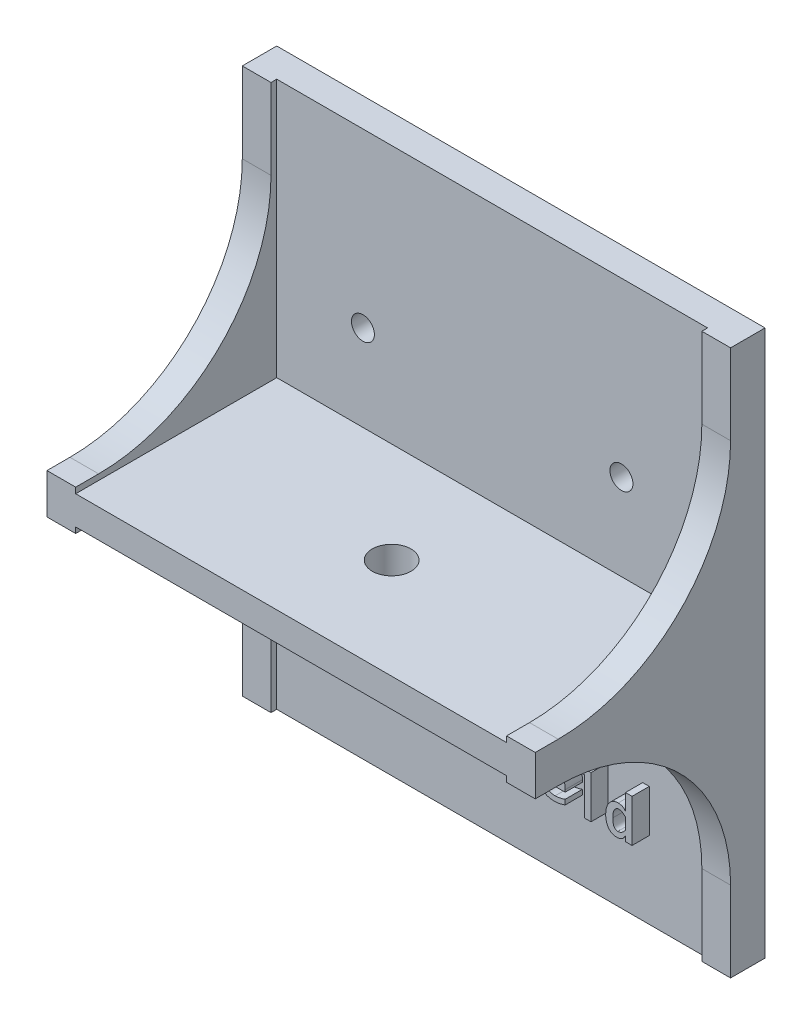
from build123d import *

# Parameters (mm, degrees)
SKETCH1_W               = 85
SKETCH1_H               = 35
SKETCH1_H_2             = 5
BOSS_EXTRUDE1_DEPTH     = 5
SKETCH1_3_W             = 85
SKETCH1_3_H             = 5
BOSS_EXTRUDE2_DEPTH     = 45
BOSS_EXTRUDE3_START     = 5
SKETCH1_4_W             = 85
SKETCH1_4_H             = 5
BOSS_EXTRUDE3_DEPTH     = 45
SKETCH2_W               = 5
SKETCH2_H               = 35
BOSS_EXTRUDE4_DEPTH     = 1
BOSS_EXTRUDE5_START     = -5
SKETCH2_2_W             = 5
SKETCH2_2_H             = 35
BOSS_EXTRUDE5_DEPTH     = 1
SKETCH3_W               = 5
SKETCH3_H               = 95
BOSS_EXTRUDE6_DEPTH     = 1
FILLET1_R               = 30
CUT_EXTRUDE1_REACH      = 106.642
SKETCH4_R               = 2
BOSS_EXTRUDE7_OUTLINE_W = 1.411764706
BOSS_EXTRUDE7_OUTLINE_H = 1.323529412
BOSS_EXTRUDE7_DEPTH     = 3
CUT_EXTRUDE2_REACH      = 106.642
SKETCH8_R               = 3.3734375


# Read off the part's stored shape, not the designer's step: Boss-Extrude7
with BuildPart() as part:
    # Sketch1 → Boss-Extrude1 (new body)
    with BuildSketch(Plane(origin=(0, 0, 0), x_dir=(1, 0, 0), z_dir=(0, 1, 0))):
        with Locations((42.5, -17.5)):
            Rectangle(SKETCH1_W, SKETCH1_H)
        with Locations((42.5, 2.5)):
            Rectangle(SKETCH1_W, SKETCH1_H_2)
    extrude(amount=BOSS_EXTRUDE1_DEPTH)

    # Sketch1<3> → Boss-Extrude2 (add)
    with BuildSketch(Plane(origin=(0, 0, 0), x_dir=(1, 0, 0), z_dir=(0, 1, 0))):
        with Locations((42.5, 2.5)):
            Rectangle(SKETCH1_3_W, SKETCH1_3_H)
    extrude(amount=-BOSS_EXTRUDE2_DEPTH)

    # Sketch1<4> → Boss-Extrude3 (add)
    with BuildSketch(Plane(origin=(0, 0, 0), x_dir=(1, 0, 0), z_dir=(0, 1, 0)).offset(BOSS_EXTRUDE3_START)):
        with Locations((42.5, 2.5)):
            Rectangle(SKETCH1_4_W, SKETCH1_4_H)
    extrude(amount=BOSS_EXTRUDE3_DEPTH)

    # Sketch2 → Boss-Extrude4 (add)
    with BuildSketch(Plane(origin=(0, 5, 0), x_dir=(1, 0, 0), z_dir=(0, 1, 0))):
        with Locations((2.5, -17.5)):
            Rectangle(SKETCH2_W, SKETCH2_H)
        with Locations((82.5, -17.5)):
            Rectangle(SKETCH2_W, SKETCH2_H)
    extrude(amount=BOSS_EXTRUDE4_DEPTH)

    # Sketch2<2> → Boss-Extrude5 (add)
    with BuildSketch(Plane(origin=(0, 5, 0), x_dir=(1, 0, 0), z_dir=(0, 1, 0)).offset(BOSS_EXTRUDE5_START)):
        with Locations((2.5, -17.5)):
            Rectangle(SKETCH2_2_W, SKETCH2_2_H)
        with Locations((82.5, -17.5)):
            Rectangle(SKETCH2_2_W, SKETCH2_2_H)
    extrude(amount=-BOSS_EXTRUDE5_DEPTH)

    # Sketch3 → Boss-Extrude6 (add)
    with BuildSketch(Plane.XY):
        with Locations((82.5, 2.5)):
            Rectangle(SKETCH3_W, SKETCH3_H)
        with Locations((2.5, 2.5)):
            Rectangle(SKETCH3_W, SKETCH3_H)
    extrude(amount=BOSS_EXTRUDE6_DEPTH)

    # Fillet1
    fillet1_edges = [part.edges().sort_by_distance(p)[0] for p in [
        (82.5, 6, 1),
        (2.5, -1, 1),
        (2.5, 6, 1),
        (82.5, -1, 1),
    ]]
    fillet(fillet1_edges, radius=FILLET1_R)

    # Sketch4 → Cut-Extrude1 (cut, up to next)
    with BuildSketch(Plane.XY, mode=Mode.PRIVATE) as cut_extrude1_sk1:
        with Locations((20, 20)):
            Circle(SKETCH4_R)
    cut_extrude1_tool1 = extrude(cut_extrude1_sk1.sketch, amount=-CUT_EXTRUDE1_REACH, mode=Mode.PRIVATE) & part.part
    # Sketch4 → Cut-Extrude1 (cut, up to next)
    with BuildSketch(Plane.XY, mode=Mode.PRIVATE) as cut_extrude1_sk2:
        with Locations((65, 20)):
            Circle(SKETCH4_R)
    cut_extrude1_tool2 = extrude(cut_extrude1_sk2.sketch, amount=-CUT_EXTRUDE1_REACH, mode=Mode.PRIVATE) & part.part
    # Sketch4 → Cut-Extrude1 (cut, up to next)
    with BuildSketch(Plane.XY, mode=Mode.PRIVATE) as cut_extrude1_sk3:
        with Locations((20, -15)):
            Circle(SKETCH4_R)
    cut_extrude1_tool3 = extrude(cut_extrude1_sk3.sketch, amount=-CUT_EXTRUDE1_REACH, mode=Mode.PRIVATE) & part.part
    # Sketch4 → Cut-Extrude1 (cut, up to next)
    with BuildSketch(Plane.XY, mode=Mode.PRIVATE) as cut_extrude1_sk4:
        with Locations((65, -15)):
            Circle(SKETCH4_R)
    cut_extrude1_tool4 = extrude(cut_extrude1_sk4.sketch, amount=-CUT_EXTRUDE1_REACH, mode=Mode.PRIVATE) & part.part
    add(cut_extrude1_tool1.solids().sort_by_distance((20, 20, 0))[0], mode=Mode.SUBTRACT)
    add(cut_extrude1_tool2.solids().sort_by_distance((65, 20, 0))[0], mode=Mode.SUBTRACT)
    add(cut_extrude1_tool3.solids().sort_by_distance((20, -15, 0))[0], mode=Mode.SUBTRACT)
    add(cut_extrude1_tool4.solids().sort_by_distance((65, -15, 0))[0], mode=Mode.SUBTRACT)

    # Boss-Extrude7 outline → Boss-Extrude7 (add)
    # profile 1 of 12: a face of its own
    with BuildSketch(Plane.XY):
        with BuildLine():
            add(Edge.make_bspline(
                [(44.463579296, -21.626187725), (44.438773811, -21.677892417), (44.390121384, -21.779303807), (44.310788685, -21.924107415), (44.224936716, -22.057149418), (44.133824302, -22.178484136), (44.038564296, -22.289552858), (43.938171564, -22.389444223), (43.83069523, -22.476400541), (43.718739377, -22.555054347), (43.596768392, -22.62156736), (43.465224971, -22.679244715), (43.322787244, -22.729921368), (43.167547133, -22.7666019), (43.002209212, -22.799406972), (42.82475431, -22.820357224), (42.636158493, -22.834879851), (42.506349024, -22.836059717), (42.439682238, -22.836665666)],
                knots=[0, 0, 0, 0, 0.067941547, 0.133257666, 0.19548435, 0.255380341, 0.312905341, 0.36873544, 0.42290793, 0.476527554, 0.530631587, 0.587189798, 0.646601196, 0.709463104, 0.775993549, 0.846233101, 0.921029297, 1, 1, 1, 1], degree=3))
            Line((44.463579296, -21.626187725), (46.994829296, -15.954312725))
            Line((46.994829296, -15.954312725), (45.947035179, -15.954312725))
            Line((45.947035179, -15.954312725), (44.400160179, -19.547143607))
            Line((44.400160179, -19.547143607), (42.89188812, -15.954312725))
            Line((42.89188812, -15.954312725), (41.700711649, -15.954312725))
            Line((41.700711649, -15.954312725), (43.797678561, -20.741077431))
            Line((43.797678561, -20.741077431), (43.579847679, -21.161573754))
            add(Edge.make_bspline(
                [(42.420380767, -21.954312725), (42.495817206, -21.952469115), (42.635726471, -21.949049838), (42.829629127, -21.924546052), (42.989556289, -21.880557797), (43.101807544, -21.826505217), (43.176500929, -21.768708908), (43.230545693, -21.714296047), (43.28811263, -21.650941375), (43.34375309, -21.574222129), (43.401729722, -21.48731994), (43.461138295, -21.38891626), (43.521299925, -21.279407656), (43.559909668, -21.20170123), (43.579847679, -21.161573754)],
                knots=[0, 0, 0, 0, 0.148333931, 0.275109633, 0.383223628, 0.473344553, 0.517807557, 0.568290922, 0.623973805, 0.685964623, 0.75438609, 0.829394684, 0.911899683, 1, 1, 1, 1], degree=3))
            Line((42.420380767, -21.954312725), (41.965417532, -21.954312725))
            Line((41.965417532, -21.954312725), (41.965417532, -22.836665666))
            Line((41.965417532, -22.836665666), (42.439682238, -22.836665666))
        make_face()
    # profile 2 of 12: a face of its own
    with BuildSketch(Plane.XY):
        with BuildLine():
            add(Edge.make_bspline(
                [(28.006318267, -27.366077431), (27.932184177, -27.36887903), (27.787471345, -27.374347868), (27.576173142, -27.412716749), (27.379386164, -27.481980497), (27.223925883, -27.558603975), (27.106172179, -27.637086156), (27.014857283, -27.704384904), (26.922490119, -27.783388243), (26.829152263, -27.873647832), (26.732660111, -27.97260153), (26.634425278, -28.081839297), (26.535573887, -28.202166228), (26.469826859, -28.286427324), (26.436005767, -28.329772283)],
                knots=[0, 0, 0, 0, 0.115716872, 0.225884154, 0.333642859, 0.440473513, 0.495387566, 0.554354922, 0.617457784, 0.684938828, 0.756975081, 0.833170303, 0.914180722, 1, 1, 1, 1], degree=3))
            add(Edge.make_bspline(
                [(28.288946943, -27.39365096), (28.244024298, -27.385611988), (28.150565195, -27.368887348), (28.05562428, -27.367037907), (28.006318267, -27.366077431)],
                knots=[0, 0, 0, 0, 0.480666343, 1, 1, 1, 1], degree=3))
            Line((28.288946943, -27.39365096), (28.288946943, -28.071959783))
            Line((28.288946943, -28.071959783), (29.259535179, -28.071959783))
            Line((29.259535179, -28.071959783), (29.259535179, -26.541628901))
            add(Edge.make_bspline(
                [(28.140049885, -26.395489195), (28.218223673, -26.397828541), (28.385043989, -26.402820629), (28.650356924, -26.429935601), (28.945268702, -26.478291316), (29.151212009, -26.519797339), (29.259535179, -26.541628901)],
                knots=[0, 0, 0, 0, 0.207440327, 0.442670895, 0.706853035, 1, 1, 1, 1], degree=3))
            add(Edge.make_bspline(
                [(26.436005767, -27.436389931), (26.477295052, -27.353656662), (26.55755714, -27.192831771), (26.714909387, -26.979750279), (26.893647322, -26.797669155), (27.098149199, -26.649927499), (27.32543421, -26.534158758), (27.57668957, -26.453176153), (27.850941634, -26.404472517), (28.041496191, -26.398551507), (28.140049885, -26.395489195)],
                knots=[0, 0, 0, 0, 0.130374219, 0.253433959, 0.372294152, 0.489388859, 0.608101896, 0.731038353, 0.860894622, 1, 1, 1, 1], degree=3))
            Line((26.436005767, -27.436389931), (26.436005767, -26.483724489))
            Line((26.436005767, -26.483724489), (25.288946943, -26.483724489))
            Line((25.288946943, -26.483724489), (25.288946943, -31.601371548))
            Line((25.288946943, -31.601371548), (26.436005767, -31.601371548))
            Line((26.436005767, -31.601371548), (26.436005767, -28.329772283))
        make_face()
    # profile 3 of 12: a face of its own
    with BuildSketch(Plane.XY):
        with BuildLine():
            add(Edge.make_bspline(
                [(32.460821943, -31.689606842), (32.388639781, -31.688530363), (32.242713507, -31.686354112), (32.020983587, -31.668809312), (31.79417074, -31.641512597), (31.561967566, -31.60237006), (31.324411292, -31.553158625), (31.082126815, -31.48991955), (30.833440193, -31.419062503), (30.667420271, -31.363512345), (30.58306459, -31.335286989)],
                knots=[0, 0, 0, 0, 0.112798808, 0.228038467, 0.347413936, 0.469741082, 0.595953648, 0.726428707, 0.860996848, 1, 1, 1, 1], degree=3))
            add(Edge.make_bspline(
                [(34.730123414, -30.082070078), (34.728359532, -30.140104529), (34.724892859, -30.254163448), (34.694747473, -30.421266653), (34.647023215, -30.580362066), (34.578552529, -30.730891061), (34.490761176, -30.872077877), (34.38470324, -31.006052935), (34.258881047, -31.131416128), (34.113740826, -31.246765718), (33.952955066, -31.35083956), (33.778785764, -31.442493649), (33.590778416, -31.517751395), (33.390692706, -31.5820837), (33.176240364, -31.628786852), (32.949476589, -31.665481573), (32.709353701, -31.685721236), (32.544956196, -31.688291467), (32.460821943, -31.689606842)],
                knots=[0, 0, 0, 0, 0.055971266, 0.110004007, 0.163320225, 0.21592138, 0.269095355, 0.323402279, 0.380481995, 0.440121857, 0.502002187, 0.565089905, 0.629745317, 0.697216212, 0.767694623, 0.841342384, 0.918803269, 1, 1, 1, 1], degree=3))
            add(Edge.make_bspline(
                [(33.471391796, -28.704772283), (33.526257441, -28.724987635), (33.632709502, -28.7642101), (33.784646452, -28.828906311), (33.923861407, -28.897240205), (34.052944738, -28.964436731), (34.167015967, -29.03909849), (34.271836779, -29.111914266), (34.360972472, -29.191872495), (34.441310575, -29.271632451), (34.508807623, -29.357130519), (34.569302516, -29.445307152), (34.618084101, -29.53981757), (34.661326527, -29.638114972), (34.689494851, -29.743106204), (34.714355364, -29.851328074), (34.728091665, -29.964987961), (34.729437005, -30.042514887), (34.730123414, -30.082070078)],
                knots=[0, 0, 0, 0, 0.087119701, 0.169032403, 0.245904079, 0.318208453, 0.385643816, 0.448928843, 0.508129041, 0.563815021, 0.617393857, 0.670192473, 0.722879958, 0.775660808, 0.829840157, 0.884506317, 0.941073704, 1, 1, 1, 1], degree=3))
            Line((33.471391796, -28.704772283), (32.357421208, -28.313228166))
            add(Edge.make_bspline(
                [(31.818358708, -27.800360519), (31.819936884, -27.826746561), (31.82308239, -27.879337297), (31.849266301, -27.955935083), (31.893440703, -28.02703772), (31.954036411, -28.093752114), (32.031068314, -28.155843423), (32.124414866, -28.213434113), (32.234238862, -28.267596747), (32.314823922, -28.297448513), (32.357421208, -28.313228166)],
                knots=[0, 0, 0, 0, 0.099609455, 0.198534301, 0.30225844, 0.414257362, 0.537760664, 0.675189254, 0.828304945, 1, 1, 1, 1], degree=3))
            add(Edge.make_bspline(
                [(32.699332973, -27.277842136), (32.634007719, -27.279312033), (32.510181515, -27.282098271), (32.335309, -27.30577167), (32.183410205, -27.34882503), (32.053304971, -27.405039802), (31.948447824, -27.479719643), (31.87164846, -27.571754503), (31.826823973, -27.681791618), (31.821241985, -27.759975845), (31.818358708, -27.800360519)],
                knots=[0, 0, 0, 0, 0.171232606, 0.324577137, 0.46110683, 0.58404839, 0.694416478, 0.795460812, 0.894348917, 1, 1, 1, 1], degree=3))
            add(Edge.make_bspline(
                [(34.465417532, -27.548062725), (34.378644995, -27.526578284), (34.209181725, -27.484620038), (33.960185682, -27.429080928), (33.722218465, -27.384314387), (33.49640596, -27.344314763), (33.280959758, -27.316380629), (33.077037266, -27.293131502), (32.884237374, -27.280582119), (32.759550109, -27.278734457), (32.699332973, -27.277842136)],
                knots=[0, 0, 0, 0, 0.149745358, 0.292446654, 0.427272499, 0.555351539, 0.676528311, 0.791127066, 0.899125785, 1, 1, 1, 1], degree=3))
            Line((34.465417532, -27.548062725), (34.465417532, -26.656059048))
            add(Edge.make_bspline(
                [(32.686924885, -26.395489195), (32.748983338, -26.396335742), (32.876432925, -26.398074296), (33.072811352, -26.411151053), (33.279127184, -26.432389646), (33.496381592, -26.459189257), (33.723578557, -26.497830079), (33.962096932, -26.540763624), (34.210366221, -26.595692521), (34.379073194, -26.635622738), (34.465417532, -26.656059048)],
                knots=[0, 0, 0, 0, 0.103337526, 0.212224512, 0.327588174, 0.448707175, 0.576656814, 0.711295065, 0.852240628, 1, 1, 1, 1], degree=3))
            add(Edge.make_bspline(
                [(30.671299885, -27.881702431), (30.672789998, -27.824157447), (30.675701414, -27.711724808), (30.701319462, -27.548105643), (30.741658003, -27.39390442), (30.802263533, -27.251011664), (30.876936276, -27.117348596), (30.968326672, -26.993304352), (31.078770131, -26.881907801), (31.203163366, -26.779284316), (31.342907407, -26.688436132), (31.496799312, -26.609564691), (31.664403807, -26.54425908), (31.843766801, -26.488288831), (32.036474901, -26.448053782), (32.24132759, -26.417941415), (32.459499016, -26.397661074), (32.609671454, -26.396226952), (32.686924885, -26.395489195)],
                knots=[0, 0, 0, 0, 0.060991391, 0.119166304, 0.175205378, 0.229603381, 0.283284924, 0.337286312, 0.392430241, 0.449216689, 0.508019046, 0.56883298, 0.632275377, 0.698564864, 0.767869152, 0.840792473, 0.918098635, 1, 1, 1, 1], degree=3))
            add(Edge.make_bspline(
                [(31.847310914, -29.236941401), (31.799771493, -29.220954482), (31.70651661, -29.189594018), (31.573269848, -29.134188952), (31.448872621, -29.075098411), (31.333486132, -29.011517868), (31.227584513, -28.942772263), (31.130657542, -28.869695698), (31.042918556, -28.791913174), (30.964417746, -28.70942569), (30.895040432, -28.62232144), (30.835250443, -28.530338213), (30.784213275, -28.43402686), (30.742283024, -28.332552803), (30.711199358, -28.226054229), (30.687392977, -28.115564478), (30.673261955, -28.000178146), (30.671962667, -27.921723258), (30.671299885, -27.881702431)],
                knots=[0, 0, 0, 0, 0.077634275, 0.152289935, 0.223260542, 0.290780266, 0.356104877, 0.418577225, 0.478552306, 0.537436995, 0.594664838, 0.650712783, 0.707049034, 0.763205267, 0.820384434, 0.878577253, 0.938060727, 1, 1, 1, 1], degree=3))
            Line((31.847310914, -29.236941401), (32.799976355, -29.548522283))
            add(Edge.make_bspline(
                [(33.58306459, -30.163411989), (33.580521839, -30.133210663), (33.575373918, -30.072066634), (33.536816492, -29.983095625), (33.471270917, -29.901624665), (33.385436762, -29.820711604), (33.272553265, -29.747709037), (33.137894549, -29.67524263), (32.977462329, -29.609044172), (32.861332853, -29.569444563), (32.799976355, -29.548522283)],
                knots=[0, 0, 0, 0, 0.085720026, 0.173544286, 0.270475441, 0.381380835, 0.507464848, 0.651235797, 0.815731969, 1, 1, 1, 1], degree=3))
            add(Edge.make_bspline(
                [(32.436005767, -30.807253901), (32.517009073, -30.804833098), (32.671993887, -30.800201341), (32.893262432, -30.766405596), (33.090936114, -30.707792815), (33.236809829, -30.637676756), (33.338095845, -30.572398548), (33.403340812, -30.521337623), (33.458778854, -30.468027377), (33.503578848, -30.4115861), (33.540307935, -30.35399213), (33.565587956, -30.292406879), (33.579160869, -30.228336374), (33.581762471, -30.185068065), (33.58306459, -30.163411989)],
                knots=[0, 0, 0, 0, 0.168521361, 0.322434391, 0.464312315, 0.596040146, 0.657575942, 0.714775856, 0.768198096, 0.81718242, 0.864418094, 0.909878094, 0.954893387, 1, 1, 1, 1], degree=3))
            add(Edge.make_bspline(
                [(30.58306459, -30.355048019), (30.677025688, -30.39112176), (30.858913114, -30.460952361), (31.127514603, -30.551270698), (31.380263936, -30.630969215), (31.619597175, -30.69426102), (31.843820085, -30.745037777), (32.054355562, -30.778726781), (32.249772786, -30.803201458), (32.375736878, -30.805942446), (32.436005767, -30.807253901)],
                knots=[0, 0, 0, 0, 0.157485181, 0.304855679, 0.44338557, 0.572123764, 0.69217228, 0.802953717, 0.905721063, 1, 1, 1, 1], degree=3))
            Line((30.58306459, -30.355048019), (30.58306459, -31.335286989))
        make_face()
    # profile 4 of 12: a face of its own
    with BuildSketch(Plane.XY):
        with BuildLine():
            add(Edge.make_bspline(
                [(39.529296208, -30.807253901), (39.625385057, -30.805431329), (39.825170962, -30.801641874), (40.136136563, -30.776807854), (40.47008659, -30.737040949), (40.699473162, -30.698837117), (40.818358708, -30.679036989)],
                knots=[0, 0, 0, 0, 0.22227031, 0.462139733, 0.721239952, 1, 1, 1, 1], degree=3))
            add(Edge.make_bspline(
                [(38.721391796, -30.621132578), (38.772878696, -30.650320065), (38.881457877, -30.711872684), (39.07299451, -30.765682243), (39.291128613, -30.802964815), (39.446832608, -30.80576884), (39.529296208, -30.807253901)],
                knots=[0, 0, 0, 0, 0.210770286, 0.444487141, 0.705790528, 1, 1, 1, 1], degree=3))
            add(Edge.make_bspline(
                [(38.524241061, -29.850452431), (38.524423817, -29.914812159), (38.524755653, -30.031672442), (38.535053225, -30.189412911), (38.546735671, -30.312697107), (38.566339402, -30.406071431), (38.596982972, -30.475404586), (38.629654668, -30.533502448), (38.671464422, -30.582585679), (38.704827622, -30.608344051), (38.721391796, -30.621132578)],
                knots=[0, 0, 0, 0, 0.233489217, 0.423954806, 0.573306014, 0.68292521, 0.768104011, 0.847328648, 0.924201669, 1, 1, 1, 1], degree=3))
            Line((38.524241061, -29.850452431), (38.524241061, -27.454312725))
            Line((38.524241061, -27.454312725), (40.730123414, -27.454312725))
            Line((40.730123414, -27.454312725), (40.730123414, -26.571959783))
            Line((40.730123414, -26.571959783), (38.524241061, -26.571959783))
            Line((38.524241061, -26.571959783), (38.524241061, -25.601371548))
            Line((38.524241061, -25.601371548), (37.377182238, -25.601371548))
            Line((37.377182238, -25.601371548), (37.377182238, -26.571959783))
            Line((37.377182238, -26.571959783), (36.14188812, -26.571959783))
            Line((36.14188812, -26.571959783), (36.14188812, -27.454312725))
            Line((36.14188812, -27.454312725), (37.377182238, -27.454312725))
            Line((37.377182238, -27.454312725), (37.377182238, -29.731886254))
            add(Edge.make_bspline(
                [(39.345932238, -31.689606842), (39.255362784, -31.688290049), (39.081358091, -31.685760187), (38.831820945, -31.666509188), (38.604133414, -31.635494213), (38.398432183, -31.591298355), (38.215265115, -31.531060121), (38.052426302, -31.462514424), (37.912520839, -31.377649065), (37.793010043, -31.277880149), (37.693761783, -31.158273846), (37.60698557, -31.020097797), (37.53655661, -30.858374949), (37.477136859, -30.675618902), (37.432863948, -30.470401047), (37.399882185, -30.243821712), (37.381149805, -29.995067224), (37.378540602, -29.821990761), (37.377182238, -29.731886254)],
                knots=[0, 0, 0, 0, 0.082899447, 0.159268852, 0.228934533, 0.293133836, 0.351534829, 0.4052264, 0.454502741, 0.500771133, 0.547039525, 0.596179207, 0.64965611, 0.708057103, 0.77184575, 0.8415711, 0.917521091, 1, 1, 1, 1], degree=3))
            add(Edge.make_bspline(
                [(40.818358708, -31.536573754), (40.684827515, -31.5604228), (40.425911371, -31.606665951), (40.046125916, -31.652084995), (39.688835128, -31.683633555), (39.457667099, -31.687660448), (39.345932238, -31.689606842)],
                knots=[0, 0, 0, 0, 0.274472408, 0.532200274, 0.773889418, 1, 1, 1, 1], degree=3))
            Line((40.818358708, -31.536573754), (40.818358708, -30.679036989))
        make_face()
    # profile 5 of 12: a face of its own
    with BuildSketch(Plane.XY):
        with BuildLine():
            add(Edge.make_bspline(
                [(56.45806459, -30.807253901), (56.517846625, -30.806157253), (56.641298931, -30.803892632), (56.831645067, -30.78569862), (57.033394815, -30.760519867), (57.245462833, -30.720313214), (57.469372988, -30.673060665), (57.70329502, -30.61096517), (57.949145527, -30.541429905), (58.115403205, -30.487499599), (58.200711649, -30.459827431)],
                knots=[0, 0, 0, 0, 0.100513314, 0.207564038, 0.321346242, 0.442310703, 0.570395085, 0.706102561, 0.849198342, 1, 1, 1, 1], degree=3))
            add(Edge.make_bspline(
                [(54.847770473, -29.395489195), (54.852217531, -29.452611851), (54.860872702, -29.563787913), (54.891226054, -29.723842583), (54.928360077, -29.873971964), (54.980367341, -30.011876073), (55.040323085, -30.14032079), (55.114117614, -30.256526011), (55.1985585, -30.36213479), (55.294381271, -30.45650052), (55.40129862, -30.539697489), (55.519327353, -30.611603908), (55.648680534, -30.672707502), (55.789349784, -30.721622302), (55.941038311, -30.760602156), (56.103429294, -30.787388519), (56.277095556, -30.804404967), (56.39644148, -30.806283789), (56.45806459, -30.807253901)],
                knots=[0, 0, 0, 0, 0.070926351, 0.138041768, 0.201561923, 0.262266703, 0.32032689, 0.376873986, 0.432356353, 0.487510592, 0.543086354, 0.59981658, 0.658390891, 0.719973019, 0.78404444, 0.852183152, 0.923676203, 1, 1, 1, 1], degree=3))
            Line((54.847770473, -29.395489195), (58.200711649, -29.395489195))
            Line((58.200711649, -29.395489195), (58.200711649, -29.019110519))
            add(Edge.make_bspline(
                [(56.030674885, -26.395489195), (56.122233353, -26.396950983), (56.299511261, -26.399781334), (56.555052153, -26.432536269), (56.79164725, -26.482862136), (57.009736561, -26.553803072), (57.20780319, -26.648496441), (57.387790574, -26.761319365), (57.546546206, -26.897288526), (57.687163884, -27.052888636), (57.808073032, -27.230201433), (57.915556137, -27.425310276), (58.002702733, -27.642517344), (58.075929174, -27.878516622), (58.13151406, -28.135126885), (58.173235469, -28.411321926), (58.19582513, -28.708529854), (58.199048086, -28.913376658), (58.200711649, -29.019110519)],
                knots=[0, 0, 0, 0, 0.070190494, 0.135904676, 0.197232244, 0.255530987, 0.311347134, 0.365228624, 0.417991588, 0.471153388, 0.525617472, 0.582248013, 0.641685496, 0.704791506, 0.771585931, 0.842874248, 0.918897869, 1, 1, 1, 1], degree=3))
            add(Edge.make_bspline(
                [(53.612476355, -29.094937725), (53.614639889, -28.999263803), (53.618885582, -28.811514435), (53.650925716, -28.536074416), (53.704492186, -28.273609036), (53.779219519, -28.023956639), (53.874427924, -27.786802269), (53.991778372, -27.56247996), (54.132320967, -27.352126504), (54.291424699, -27.155839216), (54.466335883, -26.977440236), (54.655192883, -26.821419367), (54.856059529, -26.690073596), (55.068202708, -26.58109728), (55.293020124, -26.498627355), (55.528675176, -26.439413493), (55.775841387, -26.40252273), (55.944607501, -26.397864699), (56.030674885, -26.395489195)],
                knots=[0, 0, 0, 0, 0.070722297, 0.138784597, 0.204684868, 0.268534411, 0.331184872, 0.393342353, 0.455347359, 0.517908392, 0.579893847, 0.639753321, 0.69865047, 0.756999215, 0.81569414, 0.875272361, 0.936391369, 1, 1, 1, 1], degree=3))
            add(Edge.make_bspline(
                [(56.325711649, -31.689606842), (56.220389221, -31.687506405), (56.015222668, -31.683414783), (55.716517568, -31.651187235), (55.436049813, -31.599469392), (55.173824398, -31.52708934), (54.931116199, -31.431190177), (54.706469174, -31.315630687), (54.500966907, -31.177882309), (54.313654495, -31.020655213), (54.148019792, -30.841967628), (54.003778688, -30.645536354), (53.883014035, -30.430390809), (53.783626384, -30.197933225), (53.706520927, -29.94692724), (53.652134947, -29.678652231), (53.618269556, -29.392678738), (53.614445442, -29.196138774), (53.612476355, -29.094937725)],
                knots=[0, 0, 0, 0, 0.073881228, 0.143919553, 0.210509484, 0.273799219, 0.334451831, 0.393289558, 0.450700894, 0.507672331, 0.564479301, 0.621230427, 0.678260227, 0.73719329, 0.798282266, 0.86214921, 0.92901879, 1, 1, 1, 1], degree=3))
            add(Edge.make_bspline(
                [(58.200711649, -31.320121548), (58.114066614, -31.349730606), (57.944439626, -31.407696942), (57.691275182, -31.481874591), (57.445794193, -31.545548953), (57.20773177, -31.59838604), (56.976717351, -31.638420136), (56.75318543, -31.667341614), (56.536986949, -31.686574908), (56.395143241, -31.688610455), (56.325711649, -31.689606842)],
                knots=[0, 0, 0, 0, 0.143074954, 0.280101145, 0.412133818, 0.539337913, 0.661066023, 0.778381867, 0.891519335, 1, 1, 1, 1], degree=3))
            Line((58.200711649, -31.320121548), (58.200711649, -30.459827431))
        make_face()
        with BuildLine():
            add(Edge.make_bspline(
                [(55.952090326, -27.277842136), (55.91712114, -27.279016265), (55.848230887, -27.28132933), (55.74719089, -27.29616968), (55.651015043, -27.323485657), (55.557598186, -27.3583817), (55.470107155, -27.408002193), (55.384682093, -27.464297818), (55.304551715, -27.532673151), (55.202984254, -27.638205978), (55.091556975, -27.792654326), (54.98702586, -28.006475693), (54.912636889, -28.249526605), (54.888089248, -28.423044814), (54.875344002, -28.513136254)],
                knots=[0, 0, 0, 0, 0.05815889, 0.114574604, 0.169266329, 0.224187147, 0.27993119, 0.336097918, 0.394121093, 0.45465157, 0.579381002, 0.708908533, 0.848863991, 1, 1, 1, 1], degree=3))
            add(Edge.make_bspline(
                [(56.965417532, -28.478669342), (56.96448359, -28.430405702), (56.962666563, -28.336506633), (56.952667144, -28.199943264), (56.931193062, -28.073036864), (56.904649887, -27.955069754), (56.86782878, -27.847145769), (56.826738733, -27.746943163), (56.772666682, -27.658491956), (56.714069981, -27.577319481), (56.645301154, -27.507194826), (56.571265731, -27.443765654), (56.486732756, -27.393168132), (56.395834798, -27.349451564), (56.295208999, -27.318581457), (56.187731504, -27.295523866), (56.072521449, -27.279234093), (55.993050441, -27.278315558), (55.952090326, -27.277842136)],
                knots=[0, 0, 0, 0, 0.080507356, 0.156630658, 0.228072719, 0.294997815, 0.358012594, 0.418092607, 0.475138445, 0.530475104, 0.5846803, 0.638553962, 0.692580057, 0.748465977, 0.806395665, 0.867580111, 0.931749527, 1, 1, 1, 1], degree=3))
            Line((56.965417532, -28.478669342), (56.965417532, -28.513136254))
            Line((56.965417532, -28.513136254), (54.875344002, -28.513136254))
        make_face(mode=Mode.SUBTRACT)
    # profile 6 of 12: a face of its own
    with BuildSketch(Plane.XY):
        with BuildLine():
            add(Edge.make_bspline(
                [(67.432329296, -26.395489195), (67.505065564, -26.397548915), (67.645755667, -26.401532928), (67.848426416, -26.43373641), (68.034501567, -26.48540338), (68.203822615, -26.558999011), (68.356105189, -26.654561553), (68.488802716, -26.773875921), (68.607647045, -26.911470279), (68.669238141, -27.017075575), (68.700711649, -27.071040666)],
                knots=[0, 0, 0, 0, 0.143803907, 0.27815266, 0.404759881, 0.524835637, 0.642098468, 0.758651004, 0.87666887, 1, 1, 1, 1], degree=3))
            add(Edge.make_bspline(
                [(65.259535179, -29.202474489), (65.261430753, -29.10085142), (65.265134795, -28.902275117), (65.292777682, -28.611930626), (65.339580251, -28.33585013), (65.40522183, -28.074337724), (65.489905573, -27.82727613), (65.591438961, -27.594560197), (65.713695798, -27.376825619), (65.853541976, -27.175046651), (66.008267855, -26.992208891), (66.175786542, -26.831701788), (66.356703638, -26.697176211), (66.548577686, -26.585469374), (66.753814562, -26.502010604), (66.968641918, -26.438399907), (67.196768478, -26.402750894), (67.352708126, -26.397943699), (67.432329296, -26.395489195)],
                knots=[0, 0, 0, 0, 0.076656896, 0.149791214, 0.219782233, 0.287722843, 0.352956768, 0.416600576, 0.47899802, 0.541028393, 0.601533482, 0.659406819, 0.715640095, 0.771241419, 0.826418511, 0.882374306, 0.939941538, 1, 1, 1, 1], degree=3))
            add(Edge.make_bspline(
                [(67.162108708, -31.689606842), (67.09029217, -31.687494084), (66.949614646, -31.683355516), (66.744369286, -31.650720707), (66.55069977, -31.59914056), (66.368775638, -31.524830618), (66.198909966, -31.429955597), (66.041680197, -31.312315325), (65.896298332, -31.174692622), (65.76266115, -31.017863808), (65.644652329, -30.84195992), (65.540520801, -30.651165904), (65.454446943, -30.444670859), (65.38198739, -30.224545152), (65.327888615, -29.989491806), (65.287611378, -29.740395056), (65.264387784, -29.476353125), (65.261180763, -29.295350472), (65.259535179, -29.202474489)],
                knots=[0, 0, 0, 0, 0.061075483, 0.119637453, 0.176357442, 0.23124884, 0.286391713, 0.34144441, 0.397869847, 0.456395257, 0.516365639, 0.577776865, 0.641028807, 0.706437376, 0.774721842, 0.846008629, 0.920984032, 1, 1, 1, 1], degree=3))
            add(Edge.make_bspline(
                [(68.700711649, -30.669386254), (68.661790263, -30.749971006), (68.586301518, -30.906266617), (68.44353143, -31.116563505), (68.279236058, -31.293909939), (68.095039995, -31.439951883), (67.889772066, -31.552428516), (67.664798201, -31.633254898), (67.419549249, -31.680071715), (67.249626898, -31.686365328), (67.162108708, -31.689606842)],
                knots=[0, 0, 0, 0, 0.136302951, 0.264362084, 0.385817317, 0.503552066, 0.621140807, 0.741034112, 0.866620103, 1, 1, 1, 1], degree=3))
            Line((68.700711649, -30.669386254), (68.700711649, -31.601371548))
            Line((68.700711649, -31.601371548), (69.847770473, -31.601371548))
            Line((69.847770473, -31.601371548), (69.847770473, -24.189606842))
            Line((69.847770473, -24.189606842), (68.700711649, -24.189606842))
            Line((68.700711649, -24.189606842), (68.700711649, -27.071040666))
        make_face()
        with BuildLine():
            add(Edge.make_bspline(
                [(68.700711649, -27.88583846), (68.653043286, -27.837892546), (68.560801448, -27.745113629), (68.417263136, -27.620321766), (68.273668693, -27.514649448), (68.130078455, -27.4288212), (67.987189145, -27.361162319), (67.844410783, -27.314669042), (67.702518736, -27.283413368), (67.607579124, -27.279687784), (67.560546208, -27.277842136)],
                knots=[0, 0, 0, 0, 0.152737822, 0.295559073, 0.42931947, 0.55505128, 0.673053928, 0.785689131, 0.893830773, 1, 1, 1, 1], degree=3))
            Line((68.700711649, -27.88583846), (68.700711649, -29.875268607))
            add(Edge.make_bspline(
                [(67.36063812, -30.719018607), (67.420123507, -30.716166982), (67.538950199, -30.71047064), (67.715660442, -30.670130747), (67.888617813, -30.603404243), (68.058295861, -30.508877503), (68.225522104, -30.389948017), (68.388817948, -30.242749483), (68.550058766, -30.070870735), (68.649402979, -29.941885886), (68.700711649, -29.875268607)],
                knots=[0, 0, 0, 0, 0.108542421, 0.216821936, 0.329149628, 0.445913166, 0.570446335, 0.702952284, 0.846582676, 1, 1, 1, 1], degree=3))
            add(Edge.make_bspline(
                [(66.494829296, -29.112860519), (66.49504861, -29.177680506), (66.495473593, -29.303288265), (66.507539543, -29.485340785), (66.523237263, -29.655179207), (66.546316155, -29.812215389), (66.576814726, -29.956755581), (66.613169673, -30.088842374), (66.65784303, -30.208571941), (66.707814955, -30.3163576), (66.76647443, -30.410557436), (66.829746085, -30.493819302), (66.902087488, -30.562511912), (66.98018335, -30.620807052), (67.066233108, -30.664403707), (67.158269497, -30.697119681), (67.257507501, -30.714549148), (67.325651221, -30.71750235), (67.36063812, -30.719018607)],
                knots=[0, 0, 0, 0, 0.095247147, 0.184569313, 0.268043338, 0.34589537, 0.417696024, 0.485054394, 0.547033488, 0.605345058, 0.659329875, 0.709861915, 0.758587585, 0.805466494, 0.852592915, 0.899801552, 0.948555304, 1, 1, 1, 1], degree=3))
            add(Edge.make_bspline(
                [(67.560546208, -27.277842136), (67.521812553, -27.278936932), (67.445976874, -27.281080406), (67.335403935, -27.304848031), (67.22992288, -27.339675522), (67.130998284, -27.3924822), (67.036822925, -27.457390229), (66.947752869, -27.536902157), (66.864996459, -27.631660886), (66.787790116, -27.740387143), (66.719478956, -27.863728658), (66.657622135, -28.000194301), (66.607847426, -28.151580564), (66.566560427, -28.317090976), (66.533722144, -28.495731893), (66.510485337, -28.689092249), (66.496768566, -28.8962053), (66.495487647, -29.039309642), (66.494829296, -29.112860519)],
                knots=[0, 0, 0, 0, 0.049126325, 0.096183236, 0.143076899, 0.189817683, 0.238076058, 0.288109788, 0.341052786, 0.397585383, 0.45718201, 0.519896787, 0.587650743, 0.659297063, 0.736474081, 0.818227473, 0.90657496, 1, 1, 1, 1], degree=3))
        make_face(mode=Mode.SUBTRACT)
    # profile 7 of 12: a face of its own
    with BuildSketch(Plane.XY):
        Polygon((35.965417532, -15.071959783), (35.965417532, -21.071959783), (36.847770473, -21.071959783), (36.847770473, -16.74064893), (37.943818267, -19.836665666), (38.917163855, -19.836665666), (40.024241061, -16.705874272), (40.024241061, -21.071959783), (40.994829296, -21.071959783), (40.994829296, -15.071959783), (39.65337709, -15.071959783), (38.441002793, -18.473415965), (37.275160179, -15.071959783), align=None)
    # profile 8 of 12: a face of its own
    with BuildSketch(Plane.XY):
        Polygon((13.377182238, -25.601371548), (13.377182238, -31.601371548), (14.524241061, -31.601371548), (14.524241061, -29.130783313), (17.347770473, -29.130783313), (17.347770473, -28.248430372), (14.524241061, -28.248430372), (14.524241061, -26.483724489), (17.788946943, -26.483724489), (17.788946943, -25.601371548), align=None)
    # profile 9 of 12: a face of its own
    with BuildSketch(Plane.XY):
        Polygon((20.612476355, -27.366077431), (20.612476355, -31.601371548), (21.759535179, -31.601371548), (21.759535179, -26.483724489), (18.847770473, -26.483724489), (18.847770473, -27.366077431), align=None)
    # profile 10 of 12: a face of its own
    with BuildSketch(Plane.XY):
        Polygon((47.259535179, -25.601371548), (48.140509443, -31.601371548), (49.410270473, -31.601371548), (50.12807226, -28.578791233), (50.812384443, -31.601371548), (52.018726355, -31.601371548), (52.994829296, -25.601371548), (52.058707973, -25.601371548), (51.35961344, -30.023236616), (50.699332973, -26.836665666), (49.610178561, -26.836665666), (48.845800393, -30.066133983), (48.275619738, -25.601371548), align=None)
    # profile 11 of 12: a face of its own
    with BuildSketch(Plane.XY):
        Polygon((61.553652826, -25.071959783), (61.553652826, -31.601371548), (62.700711649, -31.601371548), (62.700711649, -24.189606842), (59.612476355, -24.189606842), (59.612476355, -25.071959783), align=None)
    # profile 12 of 12: a face of its own
    with BuildSketch(Plane.XY):
        with Locations((21.14188812, -24.851371548)):
            Rectangle(BOSS_EXTRUDE7_OUTLINE_W, BOSS_EXTRUDE7_OUTLINE_H)
    extrude(amount=BOSS_EXTRUDE7_DEPTH)

    # Sketch8 → Cut-Extrude2 (cut, up to next)
    with BuildSketch(Plane(origin=(0, 5, 0), x_dir=(1, 0, 0), z_dir=(0, 1, 0)), mode=Mode.PRIVATE) as cut_extrude2_sk1:
        with Locations(Location((42.5, -17.5, 0), (0, 0, 270))):
            Circle(SKETCH8_R)
    cut_extrude2_tool1 = extrude(cut_extrude2_sk1.sketch, amount=-CUT_EXTRUDE2_REACH, mode=Mode.PRIVATE) & part.part
    add(cut_extrude2_tool1.solids().sort_by_distance((42.5, 5, 17.5))[0], mode=Mode.SUBTRACT)


solid = part.part
